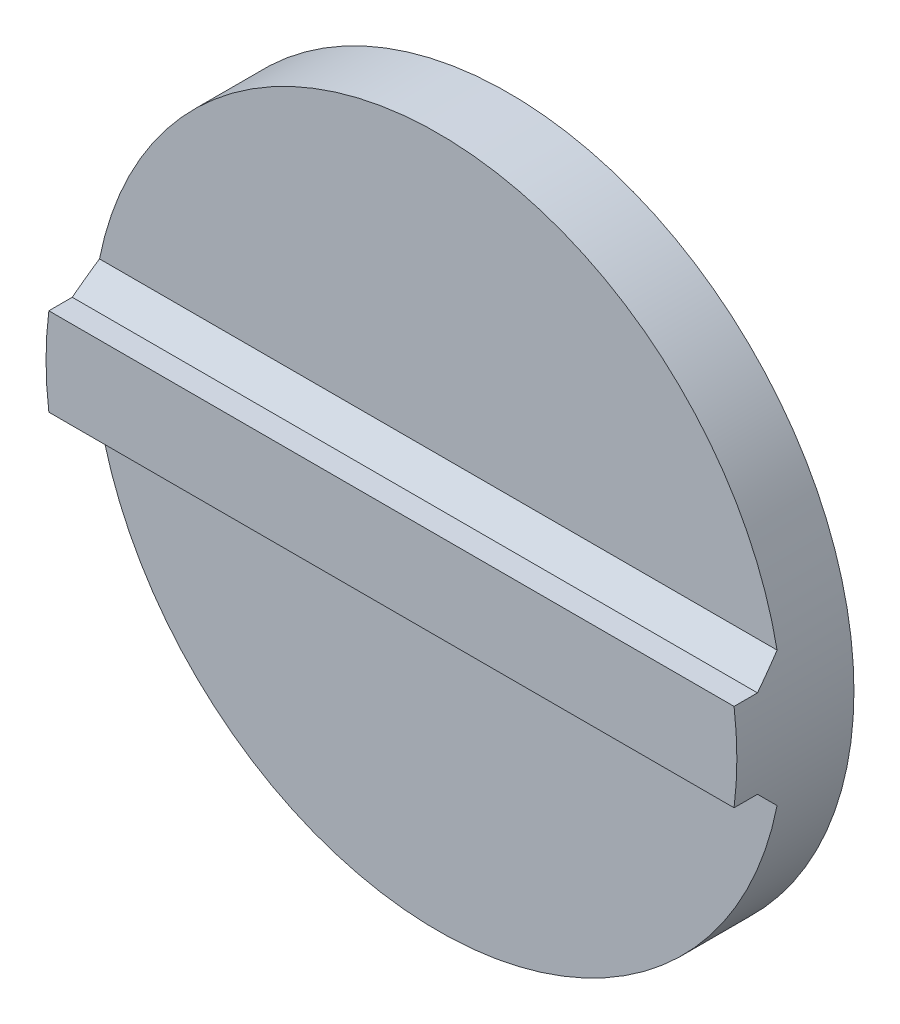
from build123d import *

# Parameters (mm, degrees)
SKETCH1_R           = 5.9
BOSS_EXTRUDE1_DEPTH = 1.2
BOSS_EXTRUDE2_DEPTH = 0.8
CHAMFER1_SIZE       = 0.4
SKETCH3_R           = 1.5
CUT_EXTRUDE1_DEPTH  = 0.5


with BuildPart() as part:
    # Sketch1 → Boss-Extrude1 (new body)
    with BuildSketch(Plane.XY):
        Circle(SKETCH1_R)
    extrude(amount=BOSS_EXTRUDE1_DEPTH)

    # Sketch2 → Boss-Extrude2 (add)
    with BuildSketch(Plane.XY.offset(1.2)):
        with BuildLine():
            Line((-5.852136362, -0.75), (5.852136362, -0.75))
            ThreePointArc((5.852136362, -0.75), (5.9, 0), (5.852136362, 0.75))
            Line((5.852136362, 0.75), (-5.852136362, 0.75))
            ThreePointArc((-5.852136362, 0.75), (-5.9, 0), (-5.852136362, -0.75))
        make_face()
    extrude(amount=BOSS_EXTRUDE2_DEPTH)

    # Chamfer1
    # the kernel refuses this chamfer: 0.4 mm, written as the material it adds along each edge
    with BuildSketch(Plane(origin=(6.880809557, 0.75, 1.2), x_dir=(0, 0.9996219169112968, -0.02749587661058628), z_dir=(-1, 0, 0))) as chamfer1_piece_1_section:
        Polygon((CHAMFER1_SIZE * 0.999621916911, -CHAMFER1_SIZE * 0.0274958766106), (-CHAMFER1_SIZE * 0.0274958766106, -CHAMFER1_SIZE * 0.999621916911), (0, 0), align=None)
    chamfer1_piece_1 = extrude(amount=13.761619114, mode=Mode.PRIVATE)
    chamfer1_piece_1 = chamfer1_piece_1 & Plane(origin=(0, 0, 1.33206261), x_dir=(1, 0, 0), z_dir=(0, 0, -1)) * Cylinder(5.9, 30, mode=Mode.PRIVATE)
    add(chamfer1_piece_1)
    with BuildSketch(Plane(origin=(-6.880809557, -0.75, 1.2), x_dir=(0, -0.9996219169112968, -0.027495876610586285), z_dir=(1, 0, 0))) as chamfer1_piece_2_section:
        Polygon((CHAMFER1_SIZE * 0.999621916911, -CHAMFER1_SIZE * 0.0274958766106), (-CHAMFER1_SIZE * 0.0274958766106, -CHAMFER1_SIZE * 0.999621916911), (0, 0), align=None)
    chamfer1_piece_2 = extrude(amount=13.761619114, mode=Mode.PRIVATE)
    chamfer1_piece_2 = chamfer1_piece_2 & Plane(origin=(0, 0, 1.33206261), x_dir=(1, 0, 0), z_dir=(0, 0, -1)) * Cylinder(5.9, 30, mode=Mode.PRIVATE)
    add(chamfer1_piece_2)

    # Sketch3 → Cut-Extrude1 (cut)
    with BuildSketch(Plane(origin=(0, 0, 0), x_dir=(-1, 0, 0), z_dir=(0, 0, -1))):
        Circle(SKETCH3_R)
    extrude(amount=-CUT_EXTRUDE1_DEPTH, mode=Mode.SUBTRACT)


solid = part.part
